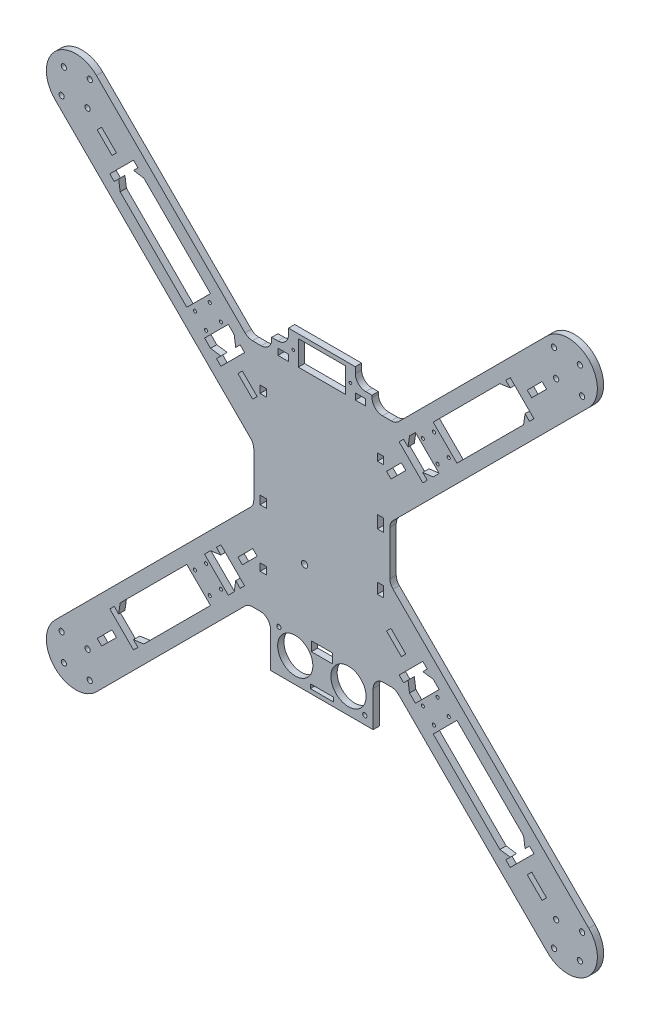
from build123d import *

# Parameters (mm, degrees)
BOSS_EXTRUDE1_DEPTH = 3
SKETCH4_R           = 1.25
CUT_EXTRUDE1_DEPTH  = 4.5
SKETCH5_R           = 0.65
SKETCH5_W           = 22.5
SKETCH5_H           = 11.8
CUT_EXTRUDE2_DEPTH  = 4.5
SKETCH6_R           = 1.5
CUT_EXTRUDE3_DEPTH  = 4.5
SKETCH7_R           = 1
SKETCH7_R_2         = 8.4
SKETCH7_W           = 10
SKETCH7_H           = 4.5
SKETCH7_W_2         = 11
SKETCH7_H_2         = 2
CUT_EXTRUDE4_DEPTH  = 4.5
CUT_EXTRUDE5_DEPTH  = 186.993279448
BOSS_EXTRUDE2_REACH = 195.992
SKETCH9_W           = 3
SKETCH9_H           = 12
BOSS_EXTRUDE3_REACH = 195.992
SKETCH11_W          = 3
SKETCH11_H          = 12
BOSS_EXTRUDE4_REACH = 195.992
SKETCH12_W          = 3
SKETCH12_H          = 12
BOSS_EXTRUDE5_REACH = 195.992
SKETCH13_W          = 3
SKETCH13_H          = 12
SKETCH14_W          = 3
SKETCH14_H          = 6
SKETCH14_H_2        = 3.5
SKETCH14_H_3        = 4
SKETCH14_H_4        = 5
CUT_EXTRUDE6_DEPTH  = 186.993279448
SKETCH15_R          = 0.75
CUT_EXTRUDE7_DEPTH  = 186.993279448
SKETCH17_W          = 8
SKETCH17_H          = 6
BOSS_EXTRUDE8_DEPTH = 3
SKETCH19_W          = 5
SKETCH19_H          = 3
CUT_EXTRUDE9_DEPTH  = 186.993279448
FILLET1_R           = 5


with BuildPart() as part:
    # Sketch1 → Boss-Extrude1 (new body)
    with BuildSketch(Plane.XY):
        with BuildLine():
            Line((35.201010127, 55), (15.95, 55))
            Line((15.95, 55), (15.95, 68.8))
            Line((15.95, 68.8), (-15.95, 68.8))
            Line((-15.95, 68.8), (-15.95, 55))
            Line((-15.95, 55), (-35.201010127, 55))
            Line((-35.201010127, 55), (-107.600505063, 127.399494937))
            ThreePointArc((-107.600505063, 127.399494937), (-127.399494937, 127.399494937), (-127.399494937, 107.600505063))
            Line((-127.399494937, 107.600505063), (-32.5, 12.701010127))
            Line((-32.5, 12.701010127), (-32.5, -12.701010127))
            Line((-32.5, -12.701010127), (-127.399494937, -107.600505063))
            ThreePointArc((-127.399494937, -107.600505063), (-127.399494937, -127.399494937), (-107.600505063, -127.399494937))
            Line((-107.600505063, -127.399494937), (-35.201010127, -55))
            Line((-35.201010127, -55), (-24.5, -55))
            Line((-24.5, -55), (-24.5, -77))
            Line((-24.5, -77), (24.5, -77))
            Line((24.5, -77), (24.5, -55))
            Line((24.5, -55), (35.201010127, -55))
            Line((35.201010127, -55), (107.600505063, -127.399494937))
            ThreePointArc((107.600505063, -127.399494937), (127.399494937, -127.399494937), (127.399494937, -107.600505063))
            Line((127.399494937, -107.600505063), (32.5, -12.701010127))
            Line((32.5, -12.701010127), (32.5, 12.701010127))
            Line((32.5, 12.701010127), (127.399494937, 107.600505063))
            ThreePointArc((127.399494937, 107.600505063), (127.399494937, 127.399494937), (107.600505063, 127.399494937))
            Line((107.600505063, 127.399494937), (35.201010127, 55))
        make_face()
    extrude(amount=-BOSS_EXTRUDE1_DEPTH)

    # Sketch4 → Cut-Extrude1 (cut)
    with BuildSketch(Plane.XY):
        with Locations((-110.782485579, 124.217514421)):
            Circle(SKETCH4_R)
        with Locations((-124.217514421, 110.782485579)):
            Circle(SKETCH4_R)
        with Locations((-123.156854249, 123.156854249)):
            Circle(SKETCH4_R)
        with Locations((-111.843145751, 111.843145751)):
            Circle(SKETCH4_R)
        with Locations((111.843145751, 111.843145751)):
            Circle(SKETCH4_R)
        with Locations((110.782485579, 124.217514421)):
            Circle(SKETCH4_R)
        with Locations((123.156854249, 123.15685425)):
            Circle(SKETCH4_R)
        with Locations((124.217514421, 110.782485579)):
            Circle(SKETCH4_R)
        with Locations((111.843145751, -111.84314575)):
            Circle(SKETCH4_R)
        with Locations((124.217514421, -110.782485579)):
            Circle(SKETCH4_R)
        with Locations((123.15685425, -123.156854249)):
            Circle(SKETCH4_R)
        with Locations((110.782485579, -124.217514421)):
            Circle(SKETCH4_R)
        with Locations((-111.84314575, -111.843145751)):
            Circle(SKETCH4_R)
        with Locations((-110.782485579, -124.217514421)):
            Circle(SKETCH4_R)
        with Locations((-123.156854249, -123.156854249)):
            Circle(SKETCH4_R)
        with Locations((-124.217514421, -110.782485579)):
            Circle(SKETCH4_R)
    extrude(amount=-CUT_EXTRUDE1_DEPTH, mode=Mode.SUBTRACT)

    # Sketch5 → Cut-Extrude2 (cut)
    with BuildSketch(Plane.XY):
        with Locations((-13.65, 60.9)):
            Circle(SKETCH5_R)
        with Locations((13.65, 60.9)):
            Circle(SKETCH5_R)
        with Locations((0, 60.9)):
            Rectangle(SKETCH5_W, SKETCH5_H)
    extrude(amount=-CUT_EXTRUDE2_DEPTH, mode=Mode.SUBTRACT)

    # Sketch6 → Cut-Extrude3 (cut)
    with BuildSketch(Plane.XY):
        with Locations((-8.25, -25)):
            Circle(SKETCH6_R)
    extrude(amount=-CUT_EXTRUDE3_DEPTH, mode=Mode.SUBTRACT)

    # Sketch7 → Cut-Extrude4 (cut)
    with BuildSketch(Plane.XY):
        with Locations((-20.5, -57)):
            Circle(SKETCH7_R)
        with Locations((-12.7, -65)):
            Circle(SKETCH7_R_2)
        with Locations((12.7, -65)):
            Circle(SKETCH7_R_2)
        with Locations((20.5, -73)):
            Circle(SKETCH7_R)
        with Locations((0, -57.25)):
            Rectangle(SKETCH7_W, SKETCH7_H)
        with Locations((0, -74)):
            Rectangle(SKETCH7_W_2, SKETCH7_H_2)
    extrude(amount=-CUT_EXTRUDE4_DEPTH, mode=Mode.SUBTRACT)

    # Sketch8 → Cut-Extrude5 (cut, through all)
    with BuildSketch(Plane.XY):
        Polygon((101.236544033, -89.922835534), (89.922835534, -101.236544033), (87.80151519, -99.115223689), (89.922835534, -96.993903346), (84.973088065, -96.286796564), (41.839574413, -53.153282912), (41.132467632, -48.203535444), (39.011147288, -50.324855787), (36.889826945, -48.203535444), (48.203535444, -36.889826945), (50.324855787, -39.011147288), (48.203535444, -41.132467632), (53.153282912, -41.839574413), (96.286796564, -84.973088065), (96.993903346, -89.922835534), (99.115223689, -87.80151519), align=None)
        Polygon((40.07180746, -37.950487117), (37.950487117, -40.07180746), (30.879419305, -33.000739648), (33.000739648, -30.879419305), align=None)
        Polygon((50.324855787, 39.011147288), (48.203535444, 36.889826945), (36.889826945, 48.203535444), (39.011147288, 50.324855787), (41.132467632, 48.203535444), (41.839574413, 53.153282912), (84.973088065, 96.286796564), (89.922835534, 96.993903346), (87.80151519, 99.115223689), (89.922835534, 101.236544033), (101.236544033, 89.922835534), (99.115223689, 87.80151519), (96.993903346, 89.922835534), (96.286796564, 84.973088065), (53.153282912, 41.839574413), (48.142875272, 41.193127804), align=None)
        Polygon((100.175883861, -98.054563517), (98.054563517, -100.175883861), (105.125631329, -107.246951673), (107.246951673, -105.125631329), align=None)
        Polygon((-101.236544033, -89.922835534), (-99.115223689, -87.80151519), (-96.993903346, -89.922835534), (-96.286796564, -84.973088065), (-53.153282912, -41.839574413), (-48.203535444, -41.132467632), (-50.324855787, -39.011147288), (-48.203535444, -36.889826945), (-36.889826945, -48.203535444), (-39.011147288, -50.324855787), (-41.132467632, -48.203535444), (-41.839574413, -53.153282912), (-84.973088065, -96.286796564), (-89.922835534, -96.993903346), (-87.80151519, -99.115223689), (-89.922835534, -101.236544033), align=None)
        Polygon((-100.175883861, -98.054563517), (-107.246951673, -105.125631329), (-105.125631329, -107.246951673), (-98.054563517, -100.175883861), align=None)
        Polygon((-37.950487117, -40.07180746), (-40.07180746, -37.950487117), (-33.000739648, -30.879419305), (-30.879419305, -33.000739648), align=None)
        Polygon((-89.922835534, 101.236544033), (-87.80151519, 99.115223689), (-89.922835534, 96.993903346), (-84.973088065, 96.286796564), (-41.839574413, 53.153282912), (-41.132467632, 48.203535444), (-39.011147288, 50.324855787), (-36.889826945, 48.203535444), (-48.203535444, 36.889826945), (-50.324855787, 39.011147288), (-48.203535444, 41.132467632), (-53.153282912, 41.839574413), (-96.286796564, 84.973088065), (-96.993903346, 89.922835534), (-99.115223689, 87.80151519), (-101.236544033, 89.922835534), align=None)
        Polygon((-98.054563517, 100.175883861), (-105.125631329, 107.246951673), (-107.246951673, 105.125631329), (-100.175883861, 98.054563517), align=None)
        Polygon((-40.07180746, 37.950487117), (-37.950487117, 40.07180746), (-30.879419305, 33.000739648), (-33.000739648, 30.879419305), align=None)
        Polygon((100.175883861, 98.054563517), (107.246951673, 105.125631329), (105.125631329, 107.246951673), (98.054563517, 100.175883861), align=None)
        Polygon((37.950487117, 40.07180746), (40.07180746, 37.950487117), (33.000739648, 30.879419305), (30.879419305, 33.000739648), align=None)
    extrude(amount=-CUT_EXTRUDE5_DEPTH, mode=Mode.SUBTRACT)

    # Sketch9 → Boss-Extrude2 (add, up to next)
    with BuildSketch(Plane(origin=(-5.656854249, 5.656854249, 0), x_dir=(0, 0, -1), z_dir=(0.70710678118654, -0.707106781186555, 0)), mode=Mode.PRIVATE) as boss_extrude2_sk1:
        with Locations((1.5, 77.170093579)):
            Rectangle(SKETCH9_W, SKETCH9_H)
    boss_extrude2_tool1 = extrude(boss_extrude2_sk1.sketch, amount=BOSS_EXTRUDE2_REACH, mode=Mode.PRIVATE) - part.part
    add(boss_extrude2_tool1.solids().sort_by_distance((48.910642, 60.224351, -1.5))[0])

    # Sketch11 → Boss-Extrude3 (add, up to next)
    with BuildSketch(Plane(origin=(5.656854249, 5.656854249, 0), x_dir=(0, 0, 1), z_dir=(-0.7071067811865477, -0.7071067811865475, 0)), mode=Mode.PRIVATE) as boss_extrude3_sk1:
        with Locations((-1.5, -77.170093579)):
            Rectangle(SKETCH11_W, SKETCH11_H)
    boss_extrude3_tool1 = extrude(boss_extrude3_sk1.sketch, amount=BOSS_EXTRUDE3_REACH, mode=Mode.PRIVATE) - part.part
    add(boss_extrude3_tool1.solids().sort_by_distance((60.224351, -48.910642, -1.5))[0])

    # Sketch12 → Boss-Extrude4 (add, up to next)
    with BuildSketch(Plane(origin=(5.656854249, -5.656854249, 0), x_dir=(0, 0, 1), z_dir=(-0.7071067811865449, 0.7071067811865502, 0)), mode=Mode.PRIVATE) as boss_extrude4_sk1:
        with Locations((-1.5, -77.170093579)):
            Rectangle(SKETCH12_W, SKETCH12_H)
    boss_extrude4_tool1 = extrude(boss_extrude4_sk1.sketch, amount=BOSS_EXTRUDE4_REACH, mode=Mode.PRIVATE) - part.part
    add(boss_extrude4_tool1.solids().sort_by_distance((-48.910642, -60.224351, -1.5))[0])

    # Sketch13 → Boss-Extrude5 (add, up to next)
    with BuildSketch(Plane(origin=(5.656854249, 5.656854249, 0), x_dir=(0, 0, 1), z_dir=(-0.707106781186552, -0.707106781186543, 0)), mode=Mode.PRIVATE) as boss_extrude5_sk1:
        with Locations((-1.5, 77.170093579)):
            Rectangle(SKETCH13_W, SKETCH13_H)
    boss_extrude5_tool1 = extrude(boss_extrude5_sk1.sketch, amount=BOSS_EXTRUDE5_REACH, mode=Mode.PRIVATE) - part.part
    add(boss_extrude5_tool1.solids().sort_by_distance((-48.910642, 60.224351, -1.5))[0])

    # Sketch14 → Cut-Extrude6 (cut, through all)
    with BuildSketch(Plane(origin=(0, 0, -3), x_dir=(-1, 0, 0), z_dir=(0, 0, -1))):
        with Locations((-28, 10)):
            Rectangle(SKETCH14_W, SKETCH14_H)
        with Locations((28, -36.75)):
            Rectangle(SKETCH14_W, SKETCH14_H_2)
        with Locations((28, -9)):
            Rectangle(SKETCH14_W, SKETCH14_H_3)
        with Locations((28, 36.75)):
            Rectangle(SKETCH14_W, SKETCH14_H_2)
        with Locations((-28, -17.5)):
            Rectangle(SKETCH14_W, SKETCH14_H_4)
        with Locations((-28, 36.75)):
            Rectangle(SKETCH14_W, SKETCH14_H_2)
    extrude(amount=-CUT_EXTRUDE6_DEPTH, mode=Mode.SUBTRACT)

    # Sketch15 → Cut-Extrude7 (cut, through all)
    with BuildSketch(Plane(origin=(0, 0, -3), x_dir=(-1, 0, 0), z_dir=(0, 0, -1))):
        with Locations((-60.577904114, -53.506836303)):
            Circle(SKETCH15_R)
        with Locations((-55.274603256, -48.203535444)):
            Circle(SKETCH15_R)
        with Locations((-48.203535444, -55.274603256)):
            Circle(SKETCH15_R)
        with Locations((-53.506836303, -60.577904114)):
            Circle(SKETCH15_R)
        with Locations((-53.506836303, 60.577904114)):
            Circle(SKETCH15_R)
        with Locations((-48.203535444, 55.274603256)):
            Circle(SKETCH15_R)
        with Locations((-60.577904114, 53.506836303)):
            Circle(SKETCH15_R)
        with Locations((-55.274603256, 48.203535444)):
            Circle(SKETCH15_R)
        with Locations((60.577904114, 53.506836303)):
            Circle(SKETCH15_R)
        with Locations((55.274603256, 48.203535444)):
            Circle(SKETCH15_R)
        with Locations((53.506836303, 60.577904114)):
            Circle(SKETCH15_R)
        with Locations((48.203535444, 55.274603256)):
            Circle(SKETCH15_R)
        with Locations((53.506836303, -60.577904114)):
            Circle(SKETCH15_R)
        with Locations((48.203535444, -55.274603256)):
            Circle(SKETCH15_R)
        with Locations((60.577904114, -53.506836303)):
            Circle(SKETCH15_R)
        with Locations((55.274603256, -48.203535444)):
            Circle(SKETCH15_R)
    extrude(amount=-CUT_EXTRUDE7_DEPTH, mode=Mode.SUBTRACT)

    # Sketch17 → Boss-Extrude8 (add)
    with BuildSketch(Plane(origin=(0, 0, -3), x_dir=(-1, 0, 0), z_dir=(0, 0, -1))):
        with Locations((19.95, 58)):
            Rectangle(SKETCH17_W, SKETCH17_H)
        with Locations((-19.95, 58)):
            Rectangle(SKETCH17_W, SKETCH17_H)
    extrude(amount=-BOSS_EXTRUDE8_DEPTH)

    # Sketch19 → Cut-Extrude9 (cut, through all)
    with BuildSketch(Plane(origin=(0, 0, -3), x_dir=(-1, 0, 0), z_dir=(0, 0, -1))):
        with Locations((18.45, 56.5)):
            Rectangle(SKETCH19_W, SKETCH19_H)
        with Locations((-18.45, 56.5)):
            Rectangle(SKETCH19_W, SKETCH19_H)
    extrude(amount=-CUT_EXTRUDE9_DEPTH, mode=Mode.SUBTRACT)

    # Fillet1
    fillet1_edges = [part.edges().sort_by_distance(p)[0] for p in [
        (-32.5, -12.701010127, -1.5),
        (-32.5, 12.701010127, -1.5),
        (32.5, 12.701010127, -1.5),
        (32.5, -12.701010127, -1.5),
        (24.5, -55, -1.5),
        (35.201010127, -55, -1.5),
        (-24.5, -55, -1.5),
        (-35.201010127, -55, -1.5),
        (15.95, 61, -1.5),
        (23.95, 55, -1.5),
        (35.201010127, 55, -1.5),
        (-15.95, 61, -1.5),
        (-23.95, 55, -1.5),
        (-35.201010127, 55, -1.5),
    ]]
    fillet(fillet1_edges, radius=FILLET1_R)


solid = part.part
